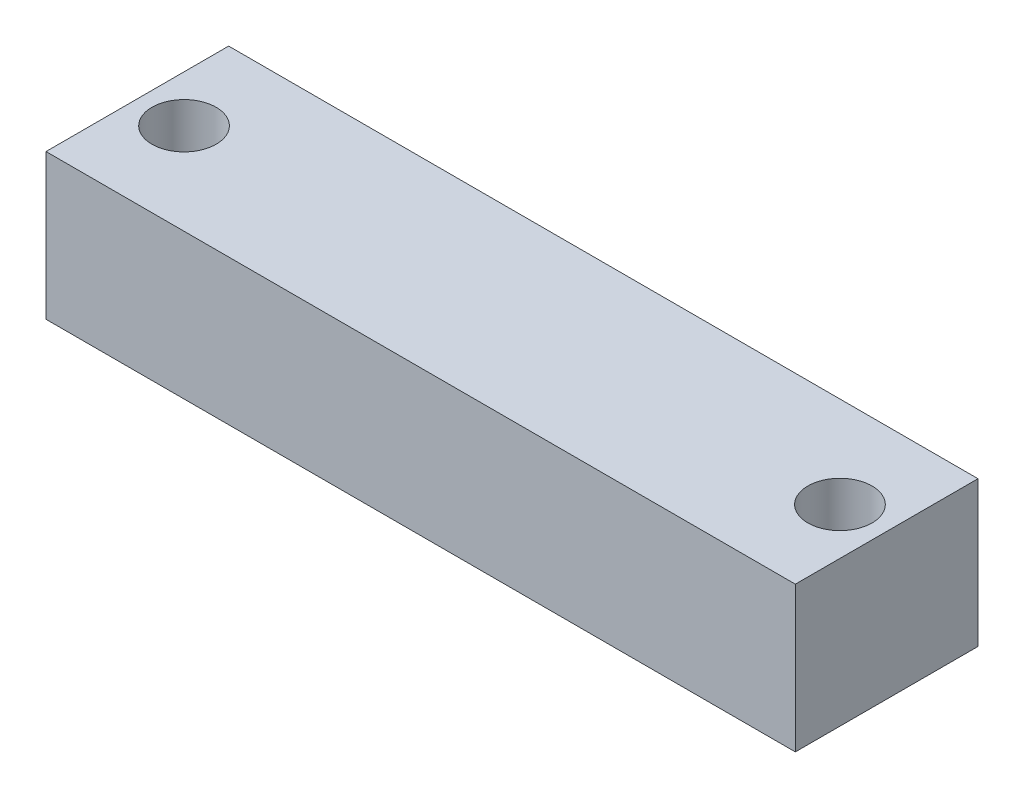
from build123d import *

# Parameters (mm, degrees)
SKETCH1_W               = 90.25
SKETCH1_H               = 22
BOSS_EXTRUDE1_DEPTH     = 17.5
CUT_EXTRUDE1_DEPTH      = 50.633815338
CUT_EXTRUDE1_DEPTH_BACK = 50.633815338
SKETCH2_R               = 1.5
SKETCH3_R               = 3.865
SKETCH3_R_2             = 1.5
CUT_EXTRUDE2_DEPTH      = 10


with BuildPart() as part:
    # Sketch1 → Boss-Extrude1 (new body)
    with BuildSketch(Plane(origin=(0, 0, 0), x_dir=(1, 0, 0), z_dir=(0, 1, 0))):
        Rectangle(SKETCH1_W, SKETCH1_H)
    extrude(amount=BOSS_EXTRUDE1_DEPTH)

    # Sketch2 → Cut-Extrude1 (cut, two sides: drawn at the far end of the back side and taken through both)
    with BuildSketch(Plane(origin=(0, 17.5, 0), x_dir=(1, 0, 0), z_dir=(0, 1, 0)).offset(-CUT_EXTRUDE1_DEPTH_BACK)):
        with Locations((-39.5, 0)):
            Circle(SKETCH2_R)
        with Locations((39.5, 0)):
            Circle(SKETCH2_R)
    extrude(amount=CUT_EXTRUDE1_DEPTH + CUT_EXTRUDE1_DEPTH_BACK, mode=Mode.SUBTRACT)

    # Sketch3 → Cut-Extrude2 (cut)
    # profile 1 of 2: a face of its own
    with BuildSketch(Plane(origin=(0, 17.5, 0), x_dir=(1, 0, 0), z_dir=(0, 1, 0))):
        with Locations((-39.5, 0)):
            Circle(SKETCH3_R)
        with Locations((-39.5, 0)):
            Circle(SKETCH3_R_2, mode=Mode.SUBTRACT)
    # profile 2 of 2: a face of its own
    with BuildSketch(Plane(origin=(0, 17.5, 0), x_dir=(1, 0, 0), z_dir=(0, 1, 0))):
        with Locations((39.5, 0)):
            Circle(SKETCH3_R)
        with Locations((39.5, 0)):
            Circle(SKETCH3_R_2, mode=Mode.SUBTRACT)
    extrude(amount=-CUT_EXTRUDE2_DEPTH, mode=Mode.SUBTRACT)


solid = part.part
